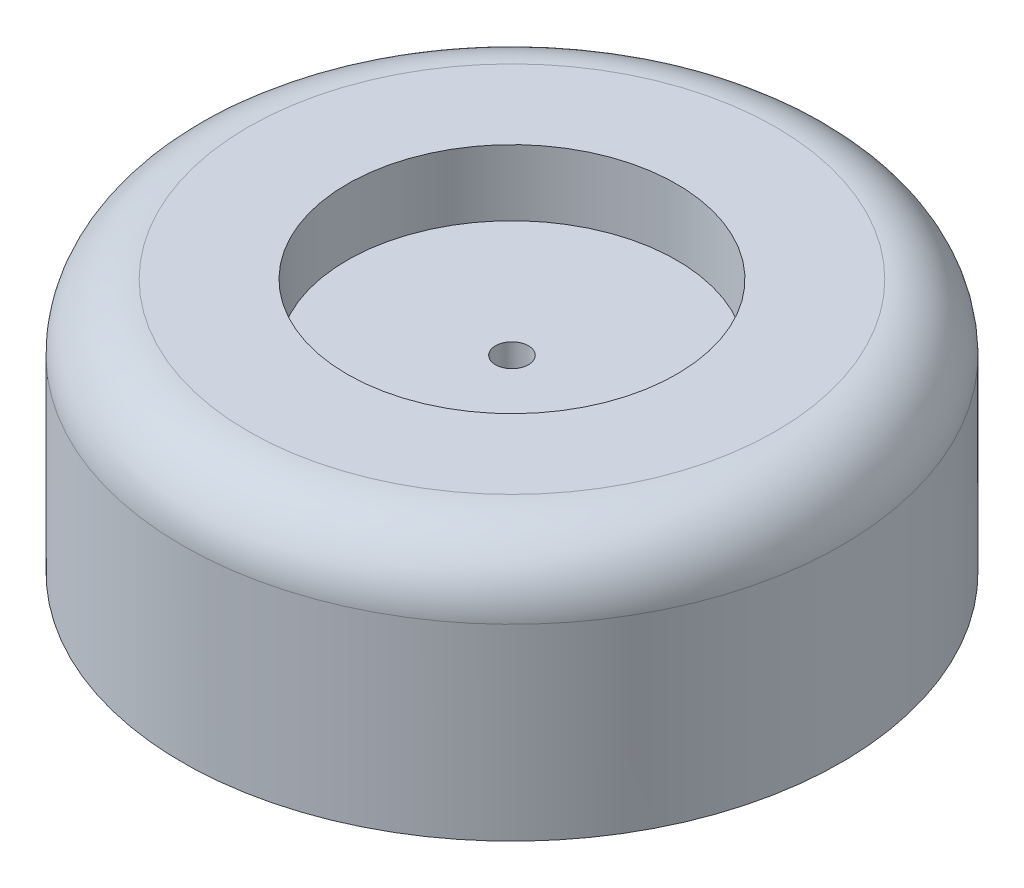
from build123d import *

# Parameters (mm, degrees)
SKETCH1_R               = 50
SKETCH1_R_2             = 47.5
BOSS_EXTRUDE1_DEPTH     = 10
SKETCH2_R               = 50
BOSS_EXTRUDE2_DEPTH     = 30
SKETCH4_R               = 2.5
SKETCH5_R               = 47.5
CUT_EXTRUDE1_DEPTH      = 1
SKETCH6_R               = 50
CUT_EXTRUDE2_DEPTH      = 1.5
CUT_EXTRUDE3_DEPTH      = 81.512421402
CUT_EXTRUDE3_DEPTH_BACK = 81.512421402
SKETCH7_R               = 2.5
SKETCH8_R               = 35
CUT_EXTRUDE4_DEPTH      = 5
FILLET1_R               = 10
SKETCH9_R               = 25
CUT_EXTRUDE5_DEPTH      = 10


with BuildPart() as part:
    # Sketch1 → Boss-Extrude1 (new body)
    with BuildSketch(Plane(origin=(0, 0, 0), x_dir=(1, 0, 0), z_dir=(0, 1, 0))):
        Circle(SKETCH1_R)
        Circle(SKETCH1_R_2, mode=Mode.SUBTRACT)
    extrude(amount=BOSS_EXTRUDE1_DEPTH)

    # Sketch2 → Boss-Extrude2 (add)
    with BuildSketch(Plane(origin=(0, 10, 0), x_dir=(1, 0, 0), z_dir=(0, 1, 0))):
        Circle(SKETCH2_R)
    extrude(amount=BOSS_EXTRUDE2_DEPTH)

    # Cut-Sweep1: sweep along a path in Sketch3
    with BuildLine(Plane.XZ.offset(-10)) as cut_sweep1_path:
        CenterArc((0, 0), 42.5, 0, 360)
    # Sketch4 → Cut-Sweep1 (sweep, cut)
    with BuildSketch(Plane.XY):
        with Locations((42.5, 10)):
            Circle(SKETCH4_R)
    sweep(path=cut_sweep1_path.line, mode=Mode.SUBTRACT)

    # Sketch5 → Cut-Extrude1 (cut)
    with BuildSketch(Plane.XZ.offset(-10)):
        Circle(SKETCH5_R)
    extrude(amount=-CUT_EXTRUDE1_DEPTH, mode=Mode.SUBTRACT)

    # Sketch6 → Cut-Extrude2 (cut)
    with BuildSketch(Plane.XZ):
        Circle(SKETCH6_R)
    extrude(amount=-CUT_EXTRUDE2_DEPTH, mode=Mode.SUBTRACT)

    # Sketch7 → Cut-Extrude3 (cut, two sides: drawn at the far end of the back side and taken through both)
    with BuildSketch(Plane(origin=(0, 40, 0), x_dir=(1, 0, 0), z_dir=(0, 1, 0)).offset(-CUT_EXTRUDE3_DEPTH_BACK)):
        Circle(SKETCH7_R)
    extrude(amount=CUT_EXTRUDE3_DEPTH + CUT_EXTRUDE3_DEPTH_BACK, mode=Mode.SUBTRACT)

    # Sketch8 → Cut-Extrude4 (cut)
    with BuildSketch(Plane.XZ.offset(-11)):
        Circle(SKETCH8_R)
    extrude(amount=-CUT_EXTRUDE4_DEPTH, mode=Mode.SUBTRACT)

    # Fillet1
    fillet1_edges = [part.edges().sort_by_distance(p)[0] for p in [
        (-50, 40, 0),
    ]]
    fillet(fillet1_edges, radius=FILLET1_R)

    # Sketch9 → Cut-Extrude5 (cut)
    with BuildSketch(Plane(origin=(0, 40, 0), x_dir=(1, 0, 0), z_dir=(0, 1, 0))):
        Circle(SKETCH9_R)
    extrude(amount=-CUT_EXTRUDE5_DEPTH, mode=Mode.SUBTRACT)


solid = part.part
